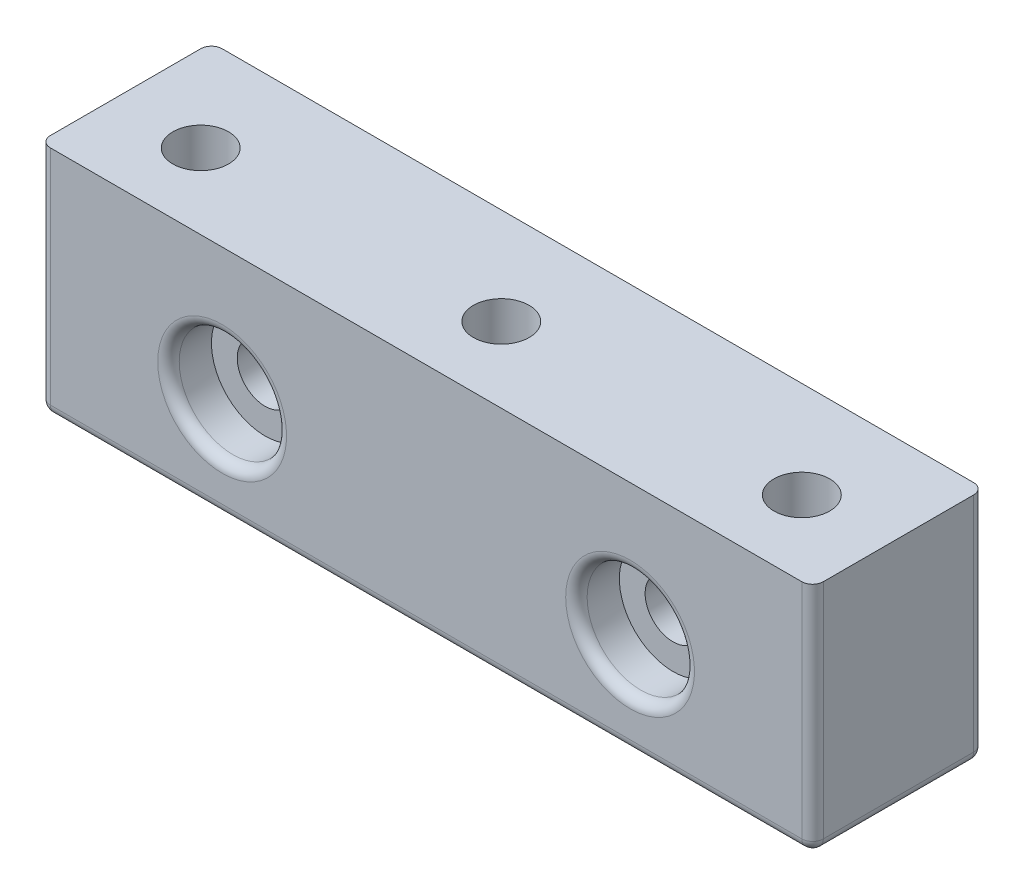
from build123d import *

# Parameters (mm, degrees)
SKETCH1_W           = 72
SKETCH1_H           = 21.75
SKETCH1_R           = 2.6
BOSS_EXTRUDE1_DEPTH = 16
SKETCH2_R           = 5
CUT_EXTRUDE1_DEPTH  = 4
SKETCH3_R           = 2.6
CUT_EXTRUDE2_DEPTH  = 21.75
SKETCH4_R           = 5
CUT_EXTRUDE3_DEPTH  = 1
FILLET1_R           = 1


with BuildPart() as part:
    # Sketch1 → Boss-Extrude1 (new body)
    with BuildSketch(Plane.XY):
        Rectangle(SKETCH1_W, SKETCH1_H)
        with Locations((-19, -1.375)):
            Circle(SKETCH1_R, mode=Mode.SUBTRACT)
        with Locations(Location((19, -1.375, 0), (0, 0, 180))):
            Circle(SKETCH1_R, mode=Mode.SUBTRACT)
    extrude(amount=BOSS_EXTRUDE1_DEPTH)

    # Sketch2 → Cut-Extrude1 (cut)
    with BuildSketch(Plane.XY.offset(16)):
        with Locations((-19, -1.375)):
            Circle(SKETCH2_R)
        with Locations((19, -1.375)):
            Circle(SKETCH2_R)
    extrude(amount=-CUT_EXTRUDE1_DEPTH, mode=Mode.SUBTRACT)

    # Sketch3 → Cut-Extrude2 (cut)
    with BuildSketch(Plane(origin=(0, 10.875, 0), x_dir=(1, 0, 0), z_dir=(0, 1, 0))):
        with Locations(Location((0, -9, 0), (0, 0, 270))):
            Circle(SKETCH3_R)
        with Locations(Location((-28, -9, 0), (0, 0, 270))):
            Circle(SKETCH3_R)
        with Locations(Location((28, -9, 0), (0, 0, 270))):
            Circle(SKETCH3_R)
    extrude(amount=-CUT_EXTRUDE2_DEPTH, mode=Mode.SUBTRACT)

    # Sketch4 → Cut-Extrude3 (cut)
    with BuildSketch(Plane.XZ.offset(10.875)):
        with Locations((-28, 9)):
            Circle(SKETCH4_R)
        with Locations((0, 9)):
            Circle(SKETCH4_R)
        with Locations((28, 9)):
            Circle(SKETCH4_R)
    extrude(amount=-CUT_EXTRUDE3_DEPTH, mode=Mode.SUBTRACT)

    # Fillet1
    fillet1_edges = [part.edges().sort_by_distance(p)[0] for p in [
        (-36, 0, 16),
        (0, -10.875, 16),
        (-24, -1.375, 16),
        (14, -1.375, 16),
        (36, 0, 16),
        (0, -10.875, 0),
        (-33, -10.875, 9),
        (-36, 0, 0),
        (-5, -10.875, 9),
        (36, 0, 0),
        (23, -10.875, 9),
        (36, -10.875, 8),
        (-36, -10.875, 8),
    ]]
    fillet(fillet1_edges, radius=FILLET1_R - 0.0001)  # a hair under: the kernel refuses the full size


solid = part.part
